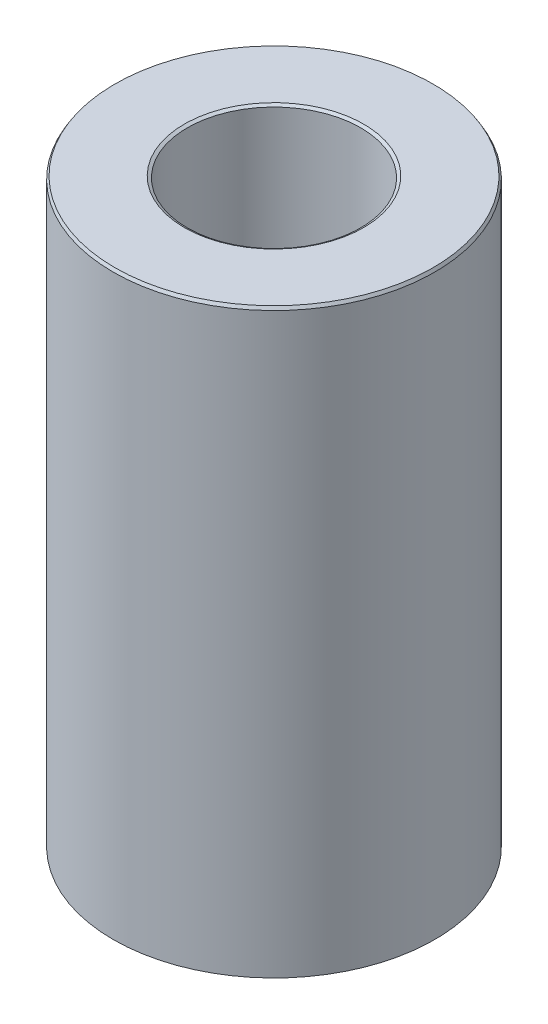
from build123d import *
from OCP.BRepFilletAPI import BRepFilletAPI_MakeChamfer

# Parameters (mm, degrees)
SKETCH1_R           = 47.5
BOSS_EXTRUDE1_DEPTH = 172.1198035
SKETCH2_R           = 25.612497428
CUT_EXTRUDE1_DEPTH  = 185.763975809
CHAMFER1_SIZE       = 0.876050792
CHAMFER1_SIZE2      = 0.505788161


with BuildPart() as part:
    # Sketch1 → Boss-Extrude1 (new body)
    with BuildSketch(Plane(origin=(0, 0, 0), x_dir=(1, 0, 0), z_dir=(0, 1, 0))):
        Circle(SKETCH1_R)
    extrude(amount=BOSS_EXTRUDE1_DEPTH)

    # Sketch2 → Cut-Extrude1 (cut, through all)
    with BuildSketch(Plane(origin=(0, 0, 0), x_dir=(1, 0, 0), z_dir=(0, 1, 0))):
        Circle(SKETCH2_R)
    extrude(amount=CUT_EXTRUDE1_DEPTH, mode=Mode.SUBTRACT)

    # Chamfer1: one chamfer whose edges measure the first distance from different faces: ONE call of the kernel's chamfer builder (chamfer() names one face for all edges)
    chamfer1_edges_1 = [part.edges().sort_by_distance(p)[0] for p in [
        (-25.612497428, 172.1198035, 0),
    ]]
    chamfer1_side_1 = [part.faces().sort_by_distance(p)[0] for p in [
        (-46.156497116, 172.1198035, 0),
    ]]
    chamfer1_edges_2 = [part.edges().sort_by_distance(p)[0] for p in [
        (-25.612497428, 0, 0),
    ]]
    chamfer1_side_2 = [part.faces().sort_by_distance(p)[0] for p in [
        (-25.612497428, 86.05990175, 0),
    ]]
    chamfer1_edges_3 = [part.edges().sort_by_distance(p)[0] for p in [
        (-47.5, 0, 0),
    ]]
    chamfer1_side_3 = [part.faces().sort_by_distance(p)[0] for p in [
        (-46.156497116, 0, 0),
    ]]
    chamfer1_edges_4 = [part.edges().sort_by_distance(p)[0] for p in [
        (-47.5, 172.1198035, 0),
    ]]
    chamfer1_side_4 = [part.faces().sort_by_distance(p)[0] for p in [
        (-47.5, 86.05990175, 0),
    ]]
    chamfer1 = BRepFilletAPI_MakeChamfer(part.part.solid().wrapped)
    for e in chamfer1_edges_1:
        chamfer1.Add(CHAMFER1_SIZE, CHAMFER1_SIZE2, e.wrapped, chamfer1_side_1[0].wrapped)  # the first distance lies on this face
    for e in chamfer1_edges_2:
        chamfer1.Add(CHAMFER1_SIZE, CHAMFER1_SIZE2, e.wrapped, chamfer1_side_2[0].wrapped)  # the first distance lies on this face
    for e in chamfer1_edges_3:
        chamfer1.Add(CHAMFER1_SIZE, CHAMFER1_SIZE2, e.wrapped, chamfer1_side_3[0].wrapped)  # the first distance lies on this face
    for e in chamfer1_edges_4:
        chamfer1.Add(CHAMFER1_SIZE, CHAMFER1_SIZE2, e.wrapped, chamfer1_side_4[0].wrapped)  # the first distance lies on this face
    add(Compound.cast(chamfer1.Shape()), mode=Mode.REPLACE)


solid = part.part
